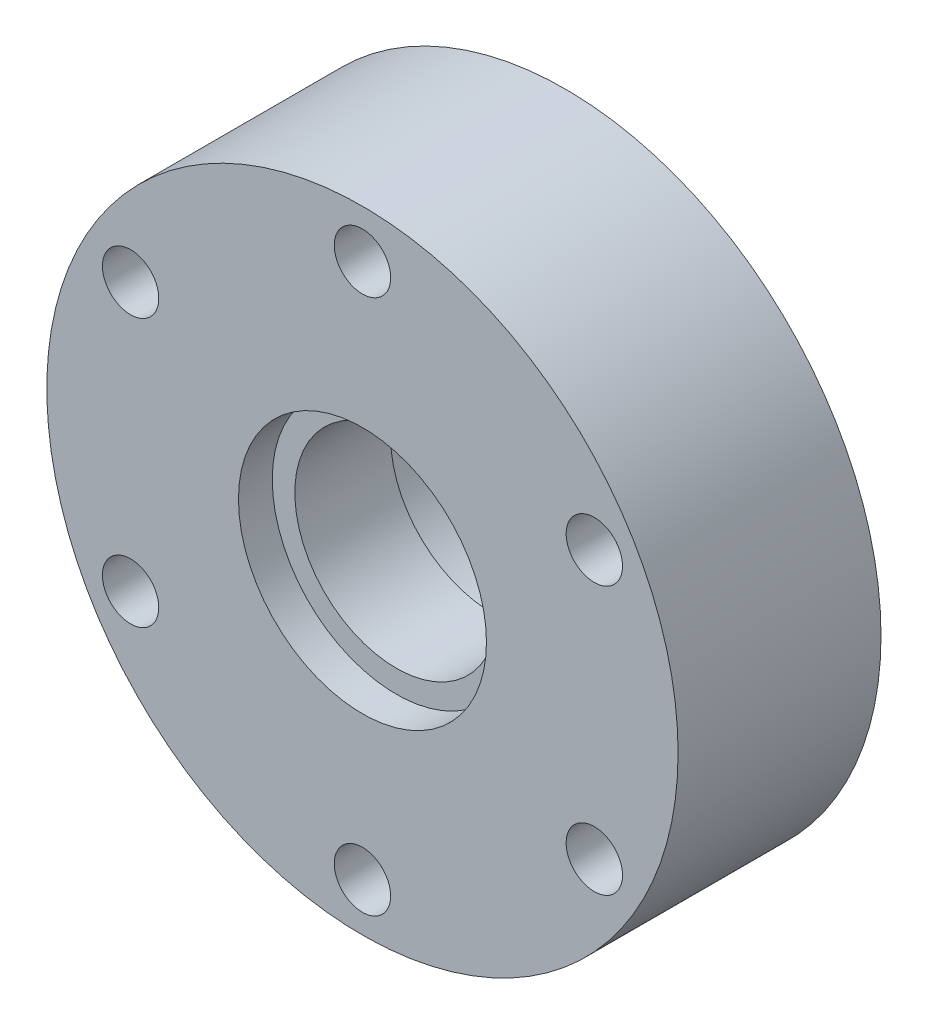
from build123d import *

# Parameters (mm, degrees)
SKETCH1_R                = 28
BOSS_EXTRUDE1_DEPTH      = 9
SKETCH2_R                = 11
CUT_EXTRUDE1_DEPTH       = 3
SKETCH3_R                = 9
CUT_EXTRUDE2_DEPTH       = 43.343830719
CUT_EXTRUDE3_START       = -6.5
SKETCH4_R                = 11
CUT_EXTRUDE3_DEPTH       = 6.5
SKETCH_1_R               = 2.5
CUT_EXTRUDE_1_DEPTH      = 44.497126342
PATTERN_CIRCULAR_1_COUNT = 6


with BuildPart() as part:
    # Sketch1 → Boss-Extrude1 (new, symmetric)
    with BuildSketch(Plane.XY):
        Circle(SKETCH1_R)
    extrude(amount=BOSS_EXTRUDE1_DEPTH, both=True)

    # Sketch2 → Cut-Extrude1 (cut)
    with BuildSketch(Plane.XY.offset(9)):
        Circle(SKETCH2_R)
    extrude(amount=-CUT_EXTRUDE1_DEPTH, mode=Mode.SUBTRACT)

    # Sketch3 → Cut-Extrude2 (cut, through all)
    with BuildSketch(Plane.XY.offset(6)):
        Circle(SKETCH3_R)
    extrude(amount=-CUT_EXTRUDE2_DEPTH, mode=Mode.SUBTRACT)

    # Sketch4 → Cut-Extrude3 (cut)
    with BuildSketch(Plane(origin=(0, 0, -9), x_dir=(-1, 0, 0), z_dir=(0, 0, -1)).offset(CUT_EXTRUDE3_START)):
        Circle(SKETCH4_R)
    extrude(amount=CUT_EXTRUDE3_DEPTH, mode=Mode.SUBTRACT)

    # 草圖1 → 除料-伸長1 (cut, through all)
    with BuildSketch(Plane.XY.offset(9)):
        with Locations((0, 23.75)):
            Circle(SKETCH_1_R)
    cut_extrude_1 = extrude(amount=-CUT_EXTRUDE_1_DEPTH, mode=Mode.SUBTRACT)

    # 環狀複製排列1: 除料-伸長1 ×6 about axis
    pattern_circular_1_axis = Axis((0, 0, 9), (0, 0, 1))
    for i in range(1, PATTERN_CIRCULAR_1_COUNT):
        add(cut_extrude_1.rotate(pattern_circular_1_axis, i * 360 / PATTERN_CIRCULAR_1_COUNT), mode=Mode.SUBTRACT)


solid = part.part
